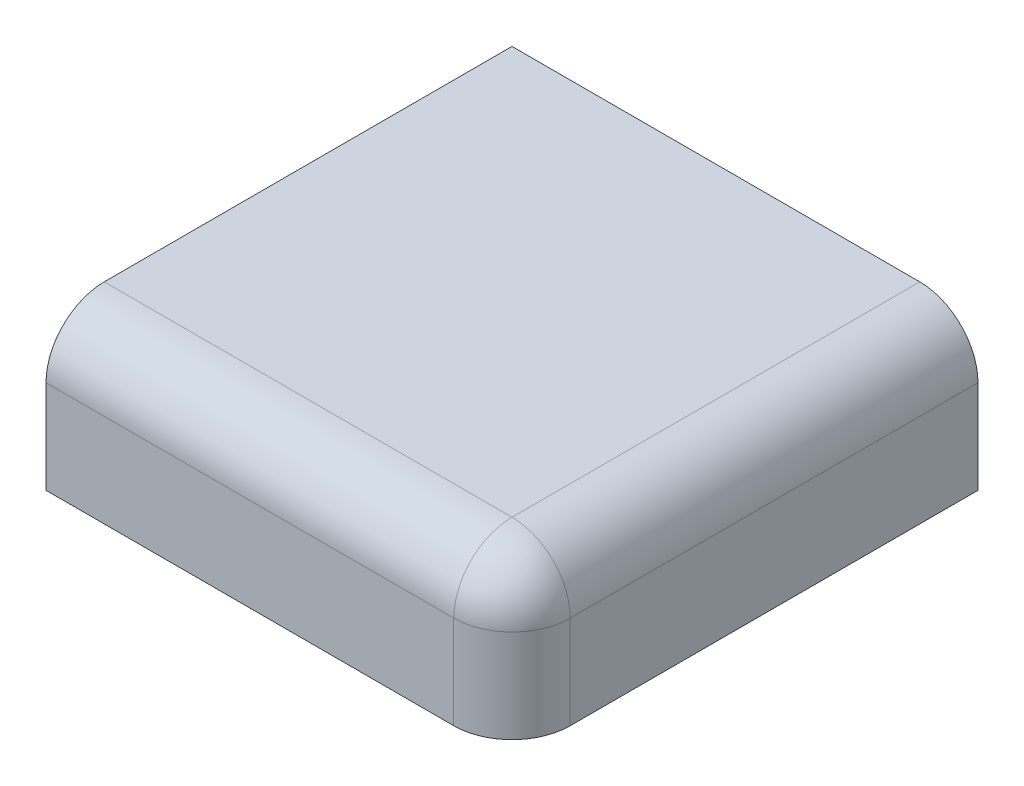
from build123d import *

# Parameters (mm, degrees)
SKETCH_1_W               = 40
SKETCH_1_H               = 40
EXTRUDE_1_DEPTH          = 13
CUT_EXTRUDE_2_DEPTH      = 2.15
PATTERN_CIRCULAR_1_COUNT = 2
PATTERN_CIRCULAR_1_ANGLE = 90
FILLET_2_R               = 5


with BuildPart() as part:
    # Эскиз1 → Бобышка-Вытянуть1 (new body)
    with BuildSketch(Plane(origin=(0, 0, 0), x_dir=(1, 0, 0), z_dir=(0, 1, 0))):
        Rectangle(SKETCH_1_W, SKETCH_1_H)
    extrude(amount=-EXTRUDE_1_DEPTH)

    # Эскиз7 → Вырез-Вытянуть2 (cut)
    with BuildSketch(Plane.ZY.offset(20)):
        with BuildLine():
            Line((-7.9625, -3.286148827), (-10, -2.109797653))
            Line((-10, -2.109797653), (-12.0375, -3.286148827))
            ThreePointArc((-12.0375, -3.286148827), (-10, -10.890202347), (-7.9625, -3.286148827))
        make_face()
        with BuildLine():
            Line((12.0375, -3.286148827), (10, -2.109797653))
            Line((10, -2.109797653), (7.9625, -3.286148827))
            ThreePointArc((7.9625, -3.286148827), (10, -10.890202347), (12.0375, -3.286148827))
        make_face()
    cut_extrude_2 = extrude(amount=-CUT_EXTRUDE_2_DEPTH, mode=Mode.SUBTRACT)

    # Круговой массив1: Вырез-Вытянуть2 ×2 about axis
    pattern_circular_1_axis = Axis((0, -13, 0), (0, -1, 0))
    for i in range(1, PATTERN_CIRCULAR_1_COUNT):
        add(cut_extrude_2.rotate(pattern_circular_1_axis, i * PATTERN_CIRCULAR_1_ANGLE / (PATTERN_CIRCULAR_1_COUNT - 1)), mode=Mode.SUBTRACT)

    # Скругление2
    fillet_2_edges = [part.edges().sort_by_distance(p)[0] for p in [
        (0, 0, 20),
        (20, 0, 0),
        (20, -6.5, 20),
    ]]
    fillet(fillet_2_edges, radius=FILLET_2_R)


solid = part.part
